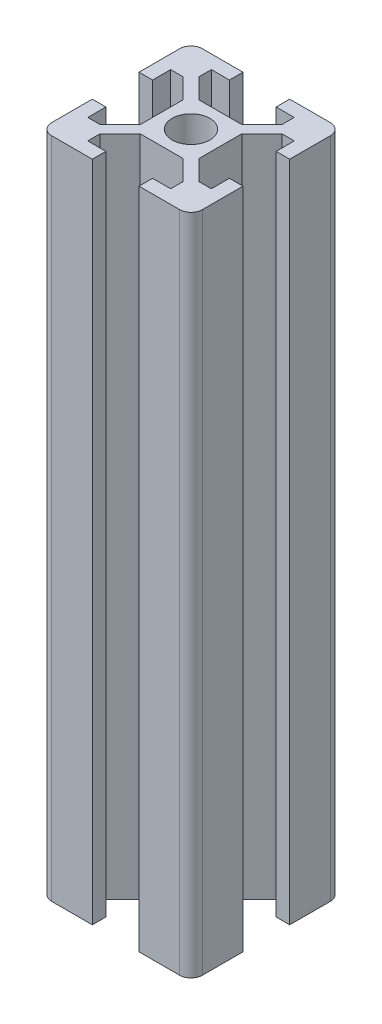
from build123d import *

# Parameters (mm, degrees)
DODANIE_WYCI_GNI_CIE1_DEPTH = 88


with BuildPart() as part:
    # Szkic1 → Dodanie-wyciągnięcie1 (new body)
    with BuildSketch(Plane(origin=(0, 0, 0), x_dir=(1, 0, 0), z_dir=(0, 1, 0))):
        with BuildLine():
            Line((2.839339828, 3.9), (0, 3.9))
            Line((0, 3.9), (-2.839339828, 3.9))
            Line((-2.839339828, 3.9), (-5.5, 6.560660172))
            Line((-5.5, 6.560660172), (-5.5, 8.2))
            Line((-5.5, 8.2), (-3.1, 8.2))
            Line((-3.1, 8.2), (-3.1, 10))
            Line((-3.1, 10), (-8.5, 10))
            ThreePointArc((-8.5, 10), (-9.560660172, 9.560660172), (-10, 8.5))
            Line((-10, 8.5), (-10, 3.1))
            Line((-10, 3.1), (-8.2, 3.1))
            Line((-8.2, 3.1), (-8.2, 5.5))
            Line((-8.2, 5.5), (-6.560660172, 5.5))
            Line((-6.560660172, 5.5), (-3.9, 2.839339828))
            Line((-3.9, 2.839339828), (-3.9, 0))
            Line((-3.9, 0), (-3.9, -2.839339828))
            Line((-3.9, -2.839339828), (-6.560660172, -5.5))
            Line((-6.560660172, -5.5), (-8.2, -5.5))
            Line((-8.2, -5.5), (-8.2, -3.1))
            Line((-8.2, -3.1), (-10, -3.1))
            Line((-10, -3.1), (-10, -8.5))
            ThreePointArc((-10, -8.5), (-9.560660172, -9.560660172), (-8.5, -10))
            Line((-8.5, -10), (-3.1, -10))
            Line((-3.1, -10), (-3.1, -8.2))
            Line((-3.1, -8.2), (-5.5, -8.2))
            Line((-5.5, -8.2), (-5.5, -6.560660172))
            Line((-5.5, -6.560660172), (-2.839339828, -3.9))
            Line((-2.839339828, -3.9), (0, -3.9))
            Line((0, -3.9), (2.839339828, -3.9))
            Line((2.839339828, -3.9), (5.5, -6.560660172))
            Line((5.5, -6.560660172), (5.5, -8.2))
            Line((5.5, -8.2), (3.1, -8.2))
            Line((3.1, -8.2), (3.1, -10))
            Line((3.1, -10), (8.5, -10))
            ThreePointArc((8.5, -10), (9.560660172, -9.560660172), (10, -8.5))
            Line((10, -8.5), (10, -3.1))
            Line((10, -3.1), (8.2, -3.1))
            Line((8.2, -3.1), (8.2, -5.5))
            Line((8.2, -5.5), (6.560660172, -5.5))
            Line((6.560660172, -5.5), (3.9, -2.839339828))
            Line((3.9, -2.839339828), (3.9, 0))
            Line((3.9, 0), (3.9, 2.839339828))
            Line((3.9, 2.839339828), (6.560660172, 5.5))
            Line((6.560660172, 5.5), (8.2, 5.5))
            Line((8.2, 5.5), (8.2, 3.1))
            Line((8.2, 3.1), (10, 3.1))
            Line((10, 3.1), (10, 8.5))
            ThreePointArc((10, 8.5), (9.560660172, 9.560660172), (8.5, 10))
            Line((8.5, 10), (3.1, 10))
            Line((3.1, 10), (3.1, 8.2))
            Line((3.1, 8.2), (5.5, 8.2))
            Line((5.5, 8.2), (5.5, 6.560660172))
            Line((5.5, 6.560660172), (2.839339828, 3.9))
        make_face()
        with BuildLine():
            ThreePointArc((0, 2.5), (1.767766953, 1.767766953), (2.5, 0))
            ThreePointArc((2.5, 0), (1.767766953, -1.767766953), (0, -2.5))
            ThreePointArc((0, -2.5), (-1.767766953, -1.767766953), (-2.5, 0))
            ThreePointArc((-2.5, 0), (-1.767766953, 1.767766953), (0, 2.5))
        make_face(mode=Mode.SUBTRACT)
    extrude(amount=DODANIE_WYCI_GNI_CIE1_DEPTH)


solid = part.part
